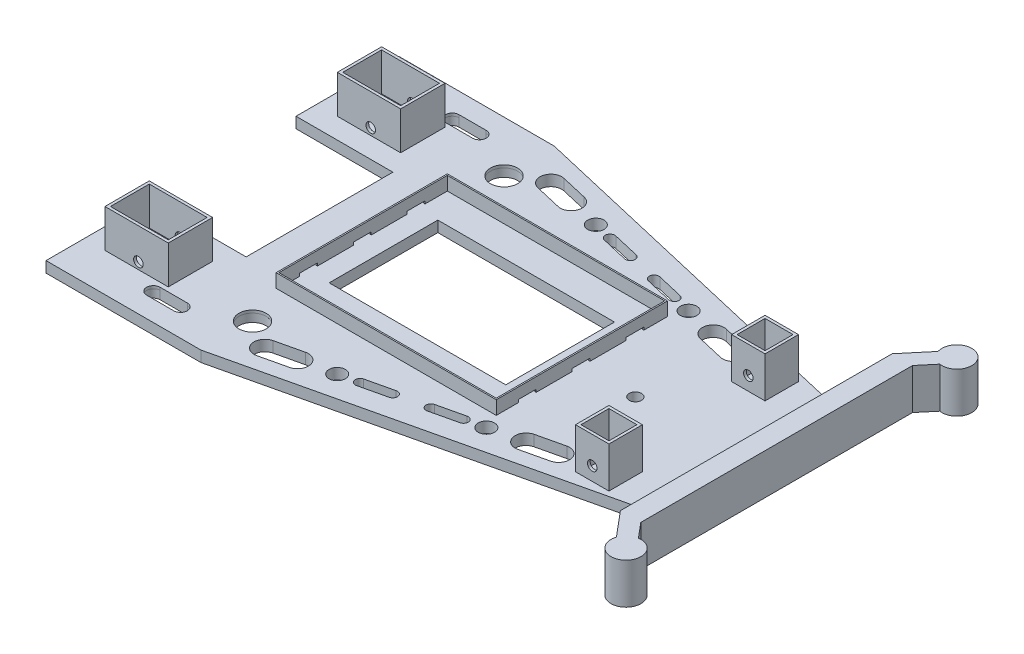
from build123d import *

# Parameters (mm, degrees)
SKETCH1_R               = 4.9999999999999964
BOSS_EXTRUDE1_DEPTH     = 1
CUT_EXTRUDE2_DEPTH      = 141.89357685856376
CUT_EXTRUDE2_DEPTH_BACK = 141.89357685856376
CUT_EXTRUDE4_DEPTH      = 1
SKETCH9_W               = 80
SKETCH9_H               = 62
EXTRUDE_THIN1_DEPTH     = 5
SKETCH10_W              = 6.522318225133077
SKETCH10_H              = 6.600000000000001
SKETCH10_W_2            = 1.9428557966278568
SKETCH10_W_3            = 2.0865154515367195
SKETCH10_H_2            = 6.599999999999956
SKETCH10_W_4            = 1.9428557966278532
SKETCH10_W_5            = 2.086515451536723
SKETCH10_W_6            = 6.52231822513307
CUT_EXTRUDE10_DEPTH     = 1
SKETCH12_R              = 2.9999999999999982
SKETCH12_R_2            = 2.999999999999995
CUT_EXTRUDE12_DEPTH     = 10
SKETCH13_R              = 4.999999999999989
BOSS_EXTRUDE2_DEPTH     = 3
CUT_EXTRUDE13_DEPTH     = 43.00000000000001
SKETCH15_R              = 2.9999999999999933
CUT_EXTRUDE14_DEPTH     = 38.000000000000014
BOSS_EXTRUDE3_DEPTH     = 15
RIB2_REACH              = 152.328
SKETCH20_WALL_W         = 318.2119999299168
SKETCH20_WALL_H         = 5
EXTRUDE_THIN2_DEPTH     = 15
SKETCH11_W              = 12.300000000000018
SKETCH11_H              = 12.299999999999997
SKETCH11_W_2            = 10.300000000000018
SKETCH11_H_2            = 10.299999999999997
EXTRUDE_THIN4_DEPTH     = 15
SKETCH22_R              = 1.749999999999997
CUT_EXTRUDE16_DEPTH     = 111.00000000000007
CUT_EXTRUDE17_DEPTH     = 77.00000000000004
CUT_EXTRUDE20_DEPTH     = 35.00000000000001
SKETCH29_R              = 2.25
SKETCH29_R_2            = 2.250000000000002
CUT_EXTRUDE21_DEPTH     = 30
CUT_EXTRUDE22_DEPTH     = 10


with BuildPart() as part:
    # Sketch1 → Boss-Extrude1 (new body)
    with BuildSketch(Plane(origin=(0, 0, 0), x_dir=(1, 0, 0), z_dir=(0, 1, 0))):
        Polygon((-124.99999999999997, -27), (-124.99999999999997, -64.99999999999997), (-54.99999999999997, -64.99999999999997), (43.750000000000036, -64.99999999999997), (125.00000000000003, 2.842e-14), (43.75000000000006, 65.00000000000003), (-54.99999999999997, 65.00000000000003), (-124.99999999999997, 65.00000000000003), (-124.99999999999997, 27), (-76.34723089658486, 27), (-76.34723089658486, -27), align=None)
        with BuildLine():
            ThreePointArc((-82.50000143028043, -57.49999999999998), (-85.00000143028043, -54.99999999999997), (-82.50000143028043, -52.499999999999964))
            Line((-82.50000143028043, -52.499999999999964), (-72.50000143028045, -52.499999999999964))
            ThreePointArc((-72.50000143028045, -52.499999999999964), (-70.00000143028043, -54.99999999999997), (-72.50000143028045, -57.49999999999998))
            Line((-72.50000143028045, -57.49999999999998), (-82.50000143028043, -57.49999999999998))
        make_face(mode=Mode.SUBTRACT)
        with Locations((-54.72271597019739, -46.267671488674864)):
            Circle(SKETCH1_R, mode=Mode.SUBTRACT)
        with Locations((-54.72271597019739, 46.267671488674864)):
            Circle(SKETCH1_R, mode=Mode.SUBTRACT)
        with BuildLine():
            Line((-72.50000143028045, 52.499999999999964), (-82.50000143028043, 52.499999999999964))
            ThreePointArc((-82.50000143028043, 52.499999999999964), (-85.00000143028043, 54.99999999999997), (-82.50000143028043, 57.49999999999998))
            Line((-82.50000143028043, 57.49999999999998), (-72.50000143028045, 57.49999999999998))
            ThreePointArc((-72.50000143028045, 57.49999999999998), (-70.00000143028043, 54.99999999999997), (-72.50000143028045, 52.499999999999964))
        make_face(mode=Mode.SUBTRACT)
    extrude(amount=BOSS_EXTRUDE1_DEPTH)

    # Sketch2 → Cut-Extrude2 (cut, two sides: drawn at the far end of the back side and taken through both)
    with BuildSketch(Plane(origin=(0, 0, 0), x_dir=(1, 0, 0), z_dir=(0, 1, 0)).offset(-CUT_EXTRUDE2_DEPTH_BACK)):
        Polygon((84.37500000000006, 32.50000000000001), (84.37500000000004, -32.500000000000014), (125.00000000000006, -9.16e-15), align=None)
    extrude(amount=CUT_EXTRUDE2_DEPTH + CUT_EXTRUDE2_DEPTH_BACK, mode=Mode.SUBTRACT)

    # Sketch3 → Cut-Extrude4 (cut)
    with BuildSketch(Plane(origin=(0, 0, 0), x_dir=(1, 0, 0), z_dir=(0, 1, 0))):
        Polygon((84.37500000000004, -32.49999999999997), (-54.999999999999964, -64.99999999999997), (84.37500000000004, -64.99999999999997), align=None)
        Polygon((84.37500000000004, 32.50000000000002), (-54.99999999999997, 65.00000000000003), (84.37500000000004, 65.00000000000003), align=None)
    extrude(amount=CUT_EXTRUDE4_DEPTH, mode=Mode.SUBTRACT)

    # Sketch9 → Extrude-Thin1 (add)
    with BuildSketch(Plane(origin=(0, 1, 0), x_dir=(1, 0, 0), z_dir=(0, 1, 0))):
        Polygon((20.187500000000032, 31.50000000000003), (-60.81249999999997, 31.500000000000032), (-60.81249999999997, -31.499999999999968), (20.187500000000014, -31.49999999999997), align=None)
        with Locations((-20.31249999999997, 3.02e-14)):
            Rectangle(SKETCH9_W, SKETCH9_H, mode=Mode.SUBTRACT)
    extrude(amount=EXTRUDE_THIN1_DEPTH)

    # Sketch10 → Cut-Extrude10 (cut)
    with BuildSketch(Plane(origin=(0, 1, 0), x_dir=(1, 0, 0), z_dir=(0, 1, 0))):
        with Locations((-60.67342012642576, -20.10065792321464)):
            Rectangle(SKETCH10_W, SKETCH10_H)
        with Locations((19.910788494607907, 19.49934207678532)):
            Rectangle(SKETCH10_W_2, SKETCH10_H)
        with Locations((-60.60761832206228, -0.3006579232146622)):
            Rectangle(SKETCH10_W_3, SKETCH10_H_2)
        with Locations((-60.53578849460785, 19.49934207678532)):
            Rectangle(SKETCH10_W_4, SKETCH10_H)
        with Locations((19.982618322062343, -0.3006579232146622)):
            Rectangle(SKETCH10_W_5, SKETCH10_H_2)
        with Locations((20.048420126425814, -20.10065792321464)):
            Rectangle(SKETCH10_W_6, SKETCH10_H)
    extrude(amount=CUT_EXTRUDE10_DEPTH, mode=Mode.SUBTRACT)

    # Sketch12 → Cut-Extrude12 (cut)
    with BuildSketch(Plane(origin=(0, 1, 0), x_dir=(1, 0, 0), z_dir=(0, 1, 0))):
        with Locations((-22.251144543561303, -47.587715157179154)):
            Circle(SKETCH12_R)
        with Locations((22.251144543561285, -37.2071419148547)):
            Circle(SKETCH12_R_2)
        with Locations((22.251144543561285, 37.207141914854716)):
            Circle(SKETCH12_R_2)
        with Locations((-22.251144543561303, 47.58771515717917)):
            Circle(SKETCH12_R)
        with BuildLine():
            Line((-44.73221717008483, -48.72425610189702), (-34.99364557581583, -46.45264361221089))
            ThreePointArc((-34.99364557581583, -46.45264361221089), (-30.18957194223399, -49.43942725404403), (-33.17635558406688, -54.24350088762588))
            Line((-33.17635558406688, -54.24350088762588), (-42.914927178335844, -56.515113377311984))
            ThreePointArc((-42.914927178335844, -56.515113377311984), (-47.719000811917944, -53.52832973547911), (-44.73221717008483, -48.72425610189702))
        make_face()
        with BuildLine():
            Line((15.036612241877956, -37.093020628637916), (5.298040647608998, -39.36463311832415))
            ThreePointArc((5.298040647608998, -39.36463311832415), (3.99132280430711, -41.46641533301627), (6.093105018999139, -42.77313317631816))
            Line((6.093105018999139, -42.77313317631816), (15.831676613268092, -40.50152068663205))
            ThreePointArc((15.831676613268092, -40.50152068663205), (17.138394456570087, -38.39973847193991), (15.036612241877956, -37.093020628637916))
        make_face()
        with BuildLine():
            Line((-15.831676613268122, -44.293336385401986), (-6.093105018999306, -42.021723895715894))
            ThreePointArc((-6.093105018999306, -42.021723895715894), (-3.9913228043071314, -43.32844173901777), (-5.298040647609016, -45.43022395370986))
            Line((-5.298040647609016, -45.43022395370986), (-15.03661224187797, -47.701836443395955))
            ThreePointArc((-15.03661224187797, -47.701836443395955), (-17.1383944565701, -46.39511860009413), (-15.831676613268122, -44.293336385401986))
        make_face()
        with BuildLine():
            Line((42.91492717833585, -28.279743694721887), (33.176355584066876, -30.551356184407997))
            ThreePointArc((33.176355584066876, -30.551356184407997), (30.189571942233865, -35.355429817990085), (34.99364557581575, -38.342213459823164))
            Line((34.99364557581575, -38.342213459823164), (44.73221717008471, -36.070600970137065))
            ThreePointArc((44.73221717008471, -36.070600970137065), (47.719000811918, -31.2665273365551), (42.91492717833585, -28.279743694721887))
        make_face()
        with BuildLine():
            Line((42.91492717833581, 28.27974369472188), (33.17635558406686, 30.55135618440801))
            ThreePointArc((33.17635558406686, 30.55135618440801), (30.18957194223373, 35.355429817990036), (34.99364557581575, 38.34221345982318))
            Line((34.99364557581575, 38.34221345982318), (44.73221717008471, 36.07060097013708))
            ThreePointArc((44.73221717008471, 36.07060097013708), (47.71900081191785, 31.266527336555022), (42.91492717833581, 28.27974369472188))
        make_face()
        with BuildLine():
            Line((15.036612241877947, 37.09302062863791), (5.298040647608998, 39.36463311832404))
            ThreePointArc((5.298040647608998, 39.36463311832404), (3.991322804307015, 41.46641533301619), (6.093105018999139, 42.773133176318176))
            Line((6.093105018999139, 42.773133176318176), (15.831676613268092, 40.50152068663206))
            ThreePointArc((15.831676613268092, 40.50152068663206), (17.13839445657011, 38.39973847193992), (15.036612241877947, 37.09302062863791))
        make_face()
        with BuildLine():
            Line((-15.831676613268089, 44.293336385402), (-6.093105018999135, 42.021723895715866))
            ThreePointArc((-6.093105018999135, 42.021723895715866), (-3.9913228043070728, 43.32844173901782), (-5.298040647609016, 45.43022395370988))
            Line((-5.298040647609016, 45.43022395370988), (-15.03661224187797, 47.70183644339597))
            ThreePointArc((-15.03661224187797, 47.70183644339597), (-17.13839445657003, 46.395118600094065), (-15.831676613268089, 44.293336385402))
        make_face()
        with BuildLine():
            Line((-44.7322171700847, 48.72425610189699), (-34.993645575815755, 46.45264361221086))
            ThreePointArc((-34.993645575815755, 46.45264361221086), (-30.189571942233783, 49.43942725404404), (-33.176355584066904, 54.24350088762598))
            Line((-33.176355584066904, 54.24350088762598), (-42.914927178335844, 56.515113377312))
            ThreePointArc((-42.914927178335844, 56.515113377312), (-47.719000811917844, 53.52832973547904), (-44.7322171700847, 48.72425610189699))
        make_face()
    extrude(amount=-CUT_EXTRUDE12_DEPTH, mode=Mode.SUBTRACT)

    # Sketch13 → Boss-Extrude2 (add)
    with BuildSketch(Plane(origin=(0, 0, 0), x_dir=(-1, 0, 0), z_dir=(0, -1, 0))):
        Polygon((125.00656482840992, 27.00000000000057), (125.00656482840994, 64.99999999999716), (55.006564828413545, 64.99999999999712), (-43.743435171589205, 64.99999999999706), (-124.99343517158547, 4.1211e-13), (-43.74343517158914, -64.99999999999615), (55.006564828413595, -64.99999999999615), (125.0065648284099, -64.99999999999615), (125.00656482840992, -26.999999999999048), (76.35379572499801, -26.999999999999048), (76.35379572499801, 27.00000000000057), align=None)
        with BuildLine():
            Line((72.50656625869378, -52.49999999999936), (82.50656625869377, -52.49999999999936))
            ThreePointArc((82.50656625869377, -52.49999999999936), (85.00656625869377, -54.99999999999937), (82.50656625869377, -57.499999999999375))
            Line((82.50656625869377, -57.499999999999375), (72.50656625869378, -57.499999999999375))
            ThreePointArc((72.50656625869378, -57.499999999999375), (70.00656625869377, -54.99999999999937), (72.50656625869378, -52.49999999999936))
        make_face(mode=Mode.SUBTRACT)
        with Locations((54.729280798610674, -46.26767148867445)):
            Circle(SKETCH13_R, mode=Mode.SUBTRACT)
        with Locations((54.72928079861002, 46.26767148867527)):
            Circle(SKETCH13_R, mode=Mode.SUBTRACT)
        with BuildLine():
            ThreePointArc((82.50656625869298, 57.50000000000058), (85.006566258693, 55.000000000000576), (82.50656625869298, 52.50000000000057))
            Line((82.50656625869298, 52.50000000000057), (72.506566258693, 52.50000000000057))
            ThreePointArc((72.506566258693, 52.50000000000057), (70.006566258693, 55.000000000000576), (72.506566258693, 57.50000000000058))
            Line((72.506566258693, 57.50000000000058), (82.50656625869298, 57.50000000000058))
        make_face(mode=Mode.SUBTRACT)
    extrude(amount=BOSS_EXTRUDE2_DEPTH)

    # Sketch14 → Cut-Extrude13 (cut)
    with BuildSketch(Plane(origin=(0, 0, 0), x_dir=(1, 0, 0), z_dir=(0, 1, 0))):
        Polygon((43.74343517158914, -64.99999999999616), (84.36573445103404, -32.502160576440474), (-54.99999999999996, -64.99999999999997), align=None)
        Polygon((124.99343517158549, 4.0452e-13), (84.37500000000006, 32.494748137268566), (84.37500000000006, -32.4947481372677), align=None)
        Polygon((43.7434351715892, 64.99999999999707), (-54.99999999999997, 65.00000000000003), (84.37500000000006, 32.494748137268566), align=None)
    extrude(amount=-CUT_EXTRUDE13_DEPTH, mode=Mode.SUBTRACT)

    # Sketch15 → Cut-Extrude14 (cut)
    with BuildSketch(Plane(origin=(0, 1, 0), x_dir=(1, 0, 0), z_dir=(0, 1, 0))):
        with BuildLine():
            Line((-34.99364557581577, -46.452643612210714), (-44.73221717008472, -48.72425610189682))
            ThreePointArc((-44.73221717008472, -48.72425610189682), (-47.71900081191786, -53.528329735478835), (-42.91492717833584, -56.51511337731198))
            Line((-42.91492717833584, -56.51511337731198), (-33.17635558406688, -54.24350088762588))
            ThreePointArc((-33.17635558406688, -54.24350088762588), (-30.189571942233748, -49.439427254043856), (-34.99364557581577, -46.452643612210714))
        make_face()
        with BuildLine():
            Line((-6.093105018999152, -42.02172389571574), (-15.831676613268103, -44.293336385401844))
            ThreePointArc((-15.831676613268103, -44.293336385401844), (-17.138394456570094, -46.39511860009395), (-15.036612241877977, -47.70183644339593))
            Line((-15.036612241877975, -47.70183644339593), (-5.2980406476090245, -45.43022395370983))
            ThreePointArc((-5.298040647609024, -45.43022395370983), (-3.9913228043070426, -43.32844173901772), (-6.093105018999151, -42.02172389571574))
        make_face()
        with BuildLine():
            Line((15.03661224187795, -37.09302062863791), (5.2980406476090005, -39.364633118324015))
            ThreePointArc((5.298040647609, -39.364633118324015), (3.991322804306993, -41.46641533301615), (6.093105018999133, -42.77313317631815))
            Line((6.093105018999134, -42.77313317631815), (15.831676613268092, -40.501520686632055))
            ThreePointArc((15.831676613268092, -40.501520686632055), (17.138394456570097, -38.39973847193991), (15.036612241877952, -37.09302062863791))
        make_face()
        with BuildLine():
            Line((42.914927178335844, -28.27974369472189), (33.176355584066876, -30.551356184407997))
            ThreePointArc((33.176355584066876, -30.551356184407993), (30.18957194223374, -35.35542981799002), (34.99364557581576, -38.34221345982316))
            Line((34.99364557581576, -38.34221345982316), (44.73221717008473, -36.07060097013706))
            ThreePointArc((44.73221717008473, -36.07060097013706), (47.719000811917866, -31.266527336555033), (42.914927178335844, -28.27974369472189))
        make_face()
        with BuildLine():
            ThreePointArc((34.99364557581575, 38.342213459823185), (30.189571942233727, 35.35542981799005), (33.17635558406686, 30.55135618440802))
            Line((33.17635558406686, 30.551356184408025), (42.914927178335844, 28.279743694721926))
            ThreePointArc((42.914927178335844, 28.279743694721926), (47.71900081191785, 31.266527336555075), (44.732217170084716, 36.07060097013709))
            Line((44.732217170084716, 36.070600970137086), (34.99364557581575, 38.342213459823185))
        make_face()
        with BuildLine():
            ThreePointArc((6.093105018999133, 42.773133176318176), (3.991322804306993, 41.46641533301618), (5.298040647609, 39.36463311832404))
            Line((5.2980406476090005, 39.36463311832404), (15.03661224187795, 37.09302062863794))
            ThreePointArc((15.036612241877952, 37.09302062863794), (17.138394456570097, 38.39973847193994), (15.831676613268092, 40.501520686632084))
            Line((15.831676613268092, 40.501520686632084), (6.093105018999134, 42.773133176318176))
        make_face()
        with BuildLine():
            ThreePointArc((-15.036612241877977, 47.70183644339595), (-17.138394456570094, 46.395118600093966), (-15.831676613268103, 44.29333638540186))
            Line((-15.831676613268103, 44.29333638540186), (-6.093105018999152, 42.02172389571575))
            ThreePointArc((-6.093105018999151, 42.02172389571575), (-3.9913228043070426, 43.328441739017734), (-5.298040647609024, 45.43022395370984))
            Line((-5.2980406476090245, 45.43022395370984), (-15.036612241877975, 47.70183644339595))
        make_face()
        with BuildLine():
            ThreePointArc((-42.91492717833584, 56.51511337731199), (-47.71900081191786, 53.52832973547885), (-44.73221717008472, 48.724256101896835))
            Line((-44.73221717008472, 48.724256101896835), (-34.99364557581577, 46.45264361221073))
            ThreePointArc((-34.99364557581577, 46.45264361221073), (-30.189571942233748, 49.43942725404387), (-33.17635558406688, 54.24350088762589))
            Line((-33.17635558406688, 54.24350088762589), (-42.91492717833584, 56.51511337731199))
        make_face()
        with Locations((-22.251144543561303, -47.587715157179154)):
            Circle(SKETCH15_R)
        with Locations((22.251144543561285, -37.2071419148547)):
            Circle(SKETCH15_R)
        with Locations((22.25114454356127, 37.20714191485473)):
            Circle(SKETCH15_R)
        with Locations((-22.251144543561303, 47.58771515717917)):
            Circle(SKETCH15_R)
    extrude(amount=-CUT_EXTRUDE14_DEPTH, mode=Mode.SUBTRACT)


with BuildPart() as boss_extrude3_tool:
    # Sketch17 → Boss-Extrude3 (new body)
    with BuildSketch(Plane(origin=(0, -3, 0), x_dir=(-1, 0, 0), z_dir=(0, -1, 0))):
        with BuildLine():
            Line((-84.37500506273139, -50), (-84.37500506273139, 49.99999999999923))
            Line((-84.37500506273139, 49.99999999999923), (-92.08159958833272, 59.18436171255014))
            ThreePointArc((-92.08159958833271, 59.18436171255014), (-100.88900153045878, 65.0597988704969), (-96.4474301138924, 55.44920398158976))
            Line((-96.4474301138924, 55.44920398158976), (-91.8750050627286, 49.99999999999923))
            Line((-91.8750050627286, 49.999999999999226), (-91.8750050627286, -50.000000000000774))
            Line((-91.8750050627286, -50.000000000000774), (-96.447430113892, -55.449203981591715))
            ThreePointArc((-96.447430113892, -55.44920398159172), (-100.88900153045743, -65.05979887049746), (-92.08159958833272, -59.18436171255169))
            Line((-92.08159958833272, -59.18436171255169), (-84.37500506273139, -50))
        make_face()
    extrude(amount=-BOSS_EXTRUDE3_DEPTH)


with BuildPart() as part_1:
    add(part.part)


with BuildPart() as part_2:
    # Boss-Extrude3: joined with boss_extrude3_tool
    add(part_1.part.fuse(boss_extrude3_tool.part, tol=0.00001))

    # Sketch20 wall → Rib2 (add, up to next)
    with BuildSketch(Plane(origin=(78.875005063, 6.5, 16.25), x_dir=(0.707106781187, 0.707106781187, 0), z_dir=(-0.707106781187, 0.707106781187, 0)), mode=Mode.PRIVATE) as rib2_sk1:
        Rectangle(SKETCH20_WALL_W, SKETCH20_WALL_H)
    rib2_tool1 = extrude(rib2_sk1.sketch, amount=-RIB2_REACH, mode=Mode.PRIVATE) - part_2.part
    rib2 = rib2_tool1.solids().sort_by_distance((78.875005063, 6.5, 16.25))[0]
    add(rib2)

    # Mirror1: Rib2 across plane
    add(rib2.mirror(Plane.XY))

    # Sketch8 → Extrude-Thin2 (add)
    # profile 1 of 2: a face of its own
    with BuildSketch(Plane(origin=(0, 0, 0), x_dir=(1, 0, 0), z_dir=(0, 1, 0))):
        Polygon((-81.09999999999998, 50.900000000000034), (-104.39999999999998, 50.90000000000004), (-104.39999999999996, 34.60000000000005), (-81.09999999999998, 34.60000000000005), align=None)
        Polygon((-82.09999999999998, 49.900000000000034), (-103.39999999999998, 49.90000000000004), (-103.39999999999996, 35.60000000000005), (-82.09999999999998, 35.60000000000005), align=None, mode=Mode.SUBTRACT)
    # profile 2 of 2: a face of its own
    with BuildSketch(Plane(origin=(0, 0, 0), x_dir=(1, 0, 0), z_dir=(0, 1, 0))):
        Polygon((-81.1, -50.90000000000004), (-81.09999999999998, -34.60000000000005), (-104.39999999999996, -34.60000000000005), (-104.39999999999998, -50.90000000000004), align=None)
        Polygon((-82.1, -49.90000000000004), (-82.09999999999998, -35.60000000000005), (-103.39999999999996, -35.60000000000005), (-103.39999999999998, -49.90000000000004), align=None, mode=Mode.SUBTRACT)
    extrude(amount=EXTRUDE_THIN2_DEPTH)

    # Sketch11 → Extrude-Thin4 (add)
    # profile 1 of 2: a face of its own
    with BuildSketch(Plane(origin=(0, 1, 0), x_dir=(1, 0, 0), z_dir=(0, 1, 0))):
        with Locations((58.87499523369031, -28.723095282233672)):
            Rectangle(SKETCH11_W, SKETCH11_H)
        with Locations((58.87499523369031, -28.723095282233672)):
            Rectangle(SKETCH11_W_2, SKETCH11_H_2, mode=Mode.SUBTRACT)
    # profile 2 of 2: a face of its own
    with BuildSketch(Plane(origin=(0, 1, 0), x_dir=(1, 0, 0), z_dir=(0, 1, 0))):
        with Locations((58.87499523369031, 28.723095282233672)):
            Rectangle(SKETCH11_W, SKETCH11_H)
        with Locations((58.87499523369031, 28.723095282233672)):
            Rectangle(SKETCH11_W_2, SKETCH11_H_2, mode=Mode.SUBTRACT)
    extrude(amount=EXTRUDE_THIN4_DEPTH)

    # Sketch22 → Cut-Extrude16 (cut)
    with BuildSketch(Plane.XY.offset(50.90000000000004)):
        with Locations((-92.1, 3.5000000000000027)):
            Circle(SKETCH22_R)
    extrude(amount=-CUT_EXTRUDE16_DEPTH, mode=Mode.SUBTRACT)

    # Sketch27 → Cut-Extrude17 (cut)
    with BuildSketch(Plane.XY.offset(34.87309528223367)):
        with BuildLine():
            ThreePointArc((58.874995233690285, 4.2499999999999964), (60.11243210076676, 4.762563132923531), (60.62499523369031, 6))
            ThreePointArc((60.62499523369031, 6), (57.63755836661385, 7.237436867076468), (58.874995233690285, 4.2499999999999964))
        make_face()
    extrude(amount=-CUT_EXTRUDE17_DEPTH, mode=Mode.SUBTRACT)

    # Sketch28 → Cut-Extrude20 (cut)
    with BuildSketch(Plane(origin=(0, 1, 0), x_dir=(1, 0, 0), z_dir=(0, 1, 0))):
        Polygon((-124.99999999999997, 65.00000000000003), (-111.99999999999997, 65.00000000000003), (-111.99999999999997, -64.99999999999997), (-124.99999999999997, -64.99999999999997), (-137.05103495931323, -64.99999999999997), (-137.05103495931326, 65.00000000000003), align=None)
    extrude(amount=-CUT_EXTRUDE20_DEPTH, mode=Mode.SUBTRACT)

    # Sketch29 → Cut-Extrude21 (cut)
    with BuildSketch(Plane(origin=(0, 1, 0), x_dir=(1, 0, 0), z_dir=(0, 1, 0))):
        with Locations((77.87499523369031, 8.55e-15)):
            Circle(SKETCH29_R)
        with Locations((39.87499523369031, 0)):
            Circle(SKETCH29_R_2)
    extrude(amount=-CUT_EXTRUDE21_DEPTH, mode=Mode.SUBTRACT)

    # Sketch30 → Cut-Extrude22 (cut)
    with BuildSketch(Plane.XZ.offset(3)):
        Polygon((-52.81251113727139, 20.000000000000746), (-52.81251113727139, -19.999999999999254), (12.187488862728607, -19.99999999999925), (12.187488862728612, 2.1316e-13), (12.187488862728614, 20.00000000000075), align=None)
    extrude(amount=-CUT_EXTRUDE22_DEPTH, mode=Mode.SUBTRACT)


solid = part_2.part
